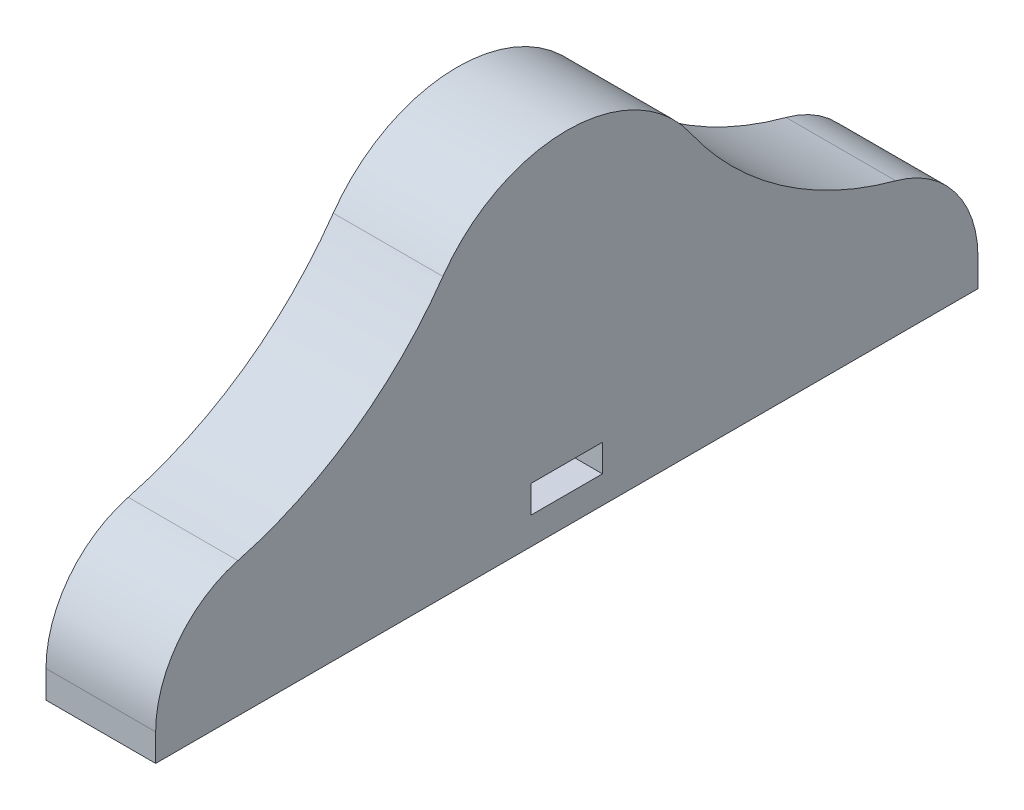
from build123d import *

# Parameters (mm, degrees)
SKETCH1_W           = 5.2
SKETCH1_H           = 2
BOSS_EXTRUDE1_DEPTH = 8


with BuildPart() as part:
    # Sketch1 → Boss-Extrude1 (new body)
    with BuildSketch(Plane(origin=(0, 0, 0), x_dir=(0, 0, -1), z_dir=(1, 0, 0))):
        with BuildLine():
            Line((0, 0), (60, 0))
            Line((60, 0), (60, 2))
            ThreePointArc((60, 2), (58.327156209, 6.928038895), (54, 9.819352237))
            ThreePointArc((54, 9.819352237), (45.597676291, 13.737420129), (39.042132847, 20.292963573))
            ThreePointArc((39.042132847, 20.292963573), (30, 25), (20.957867153, 20.292963573))
            ThreePointArc((20.957867153, 20.292963573), (14.402323709, 13.737420129), (6, 9.819352237))
            ThreePointArc((6, 9.819352237), (1.672843791, 6.928038895), (0, 2))
            Line((0, 2), (0, 0))
        make_face()
        with Locations((30, 3)):
            Rectangle(SKETCH1_W, SKETCH1_H, mode=Mode.SUBTRACT)
    extrude(amount=-BOSS_EXTRUDE1_DEPTH)


solid = part.part
